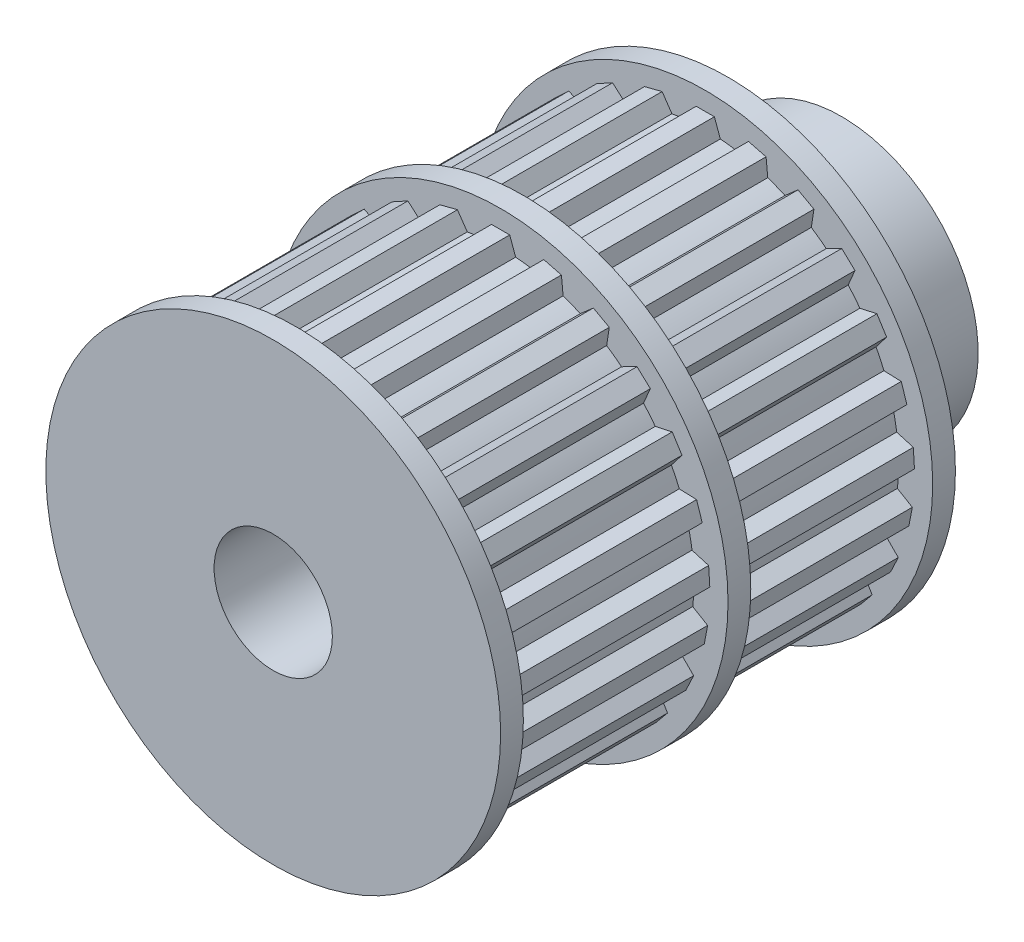
from build123d import *

# Parameters (mm, degrees)
BOSS_EXTRUDE1_DEPTH = 5
SKETCH2_R           = 10
BOSS_EXTRUDE2_DEPTH = 1
MIRROR3_START       = 5
MIRROR3_DEPTH       = 10
SKETCH4_R           = 6
BOSS_EXTRUDE3_DEPTH = 5
CUT_EXTRUDE1_REACH  = 30.723
SKETCH5_R           = 2.6


# Read off the part's stored shape, not the designer's step: Mirror3
with BuildPart() as part:
    # Sketch1 → Boss-Extrude1 (new, symmetric)
    with BuildSketch(Plane.XY):
        with BuildLine():
            Line((-0.4, 9.191300234), (-0.660980834, 8.474261286))
            ThreePointArc((-0.660980834, 8.474261286), (-1.065332485, 8.432974961), (-1.467248177, 8.372406033))
            Line((-1.467248177, 8.372406033), (-1.898350154, 9.002014591))
            Line((-1.898350154, 9.002014591), (-2.673216683, 8.803062681))
            Line((-2.673216683, 8.803062681), (-2.747677989, 8.043647535))
            ThreePointArc((-2.747677989, 8.043647535), (-3.129058698, 7.90310013), (-3.503284589, 7.744481718))
            Line((-3.503284589, 7.744481718), (-4.077419986, 8.247099263))
            Line((-4.077419986, 8.247099263), (-4.77846533, 7.861696324))
            Line((-4.77846533, 7.861696324), (-4.66172843, 7.107621828))
            ThreePointArc((-4.66172843, 7.107621828), (-4.996174644, 6.876644452), (-5.319196746, 6.629943135))
            Line((-5.319196746, 6.629943135), (-6.000290524, 6.973988359))
            Line((-6.000290524, 6.973988359), (-6.583465426, 6.426350674))
            Line((-6.583465426, 6.426350674), (-6.282865329, 5.724998101))
            ThreePointArc((-6.282865329, 5.724998101), (-6.549362564, 5.418103913), (-6.80088421, 5.098820841))
            Line((-6.80088421, 5.098820841), (-7.546140742, 5.262676117))
            Line((-7.546140742, 5.262676117), (-7.974802178, 4.587213776))
            Line((-7.974802178, 4.587213776), (-7.509226693, 3.982651688))
            ThreePointArc((-7.509226693, 3.982651688), (-7.691029946, 3.619123978), (-7.855247106, 3.247320882))
            Line((-7.855247106, 3.247320882), (-8.617839183, 3.220690579))
            Line((-8.617839183, 3.220690579), (-8.865052779, 2.459845366))
            Line((-8.865052779, 2.459845366), (-8.263755727, 1.990060623))
            ThreePointArc((-8.263755727, 1.990060623), (-8.349441631, 1.592741174), (-8.416035937, 1.191779808))
            Line((-8.416035937, 1.191779808), (-9.148047095, 0.976337208))
            Line((-9.148047095, 0.976337208), (-9.198279511, 0.177915826))
            Line((-9.198279511, 0.177915826), (-8.499042597, -0.127573271))
            ThreePointArc((-8.499042597, -0.127573271), (-8.483227192, -0.533719416), (-8.448014278, -0.938645173))
            Line((-8.448014278, -0.938645173), (-9.103449564, -1.32936302))
            Line((-9.103449564, -1.32936302), (-8.953544512, -2.115192821))
            Line((-8.953544512, -2.115192821), (-8.200303363, -2.237191266))
            ThreePointArc((-8.200303363, -2.237191266), (-8.083980389, -2.626644452), (-7.949172812, -3.010091627))
            Line((-7.949172812, -3.010091627), (-8.486848816, -3.551534481))
            Line((-8.486848816, -3.551534481), (-8.146225383, -4.275396123))
            Line((-8.146225383, -4.275396123), (-7.38630891, -4.206238307))
            ThreePointArc((-7.38630891, -4.206238307), (-7.176787367, -4.554527757), (-6.950855584, -4.892402953))
            Line((-6.950855584, -4.892402953), (-7.336988145, -5.550549969))
            Line((-7.336988145, -5.550549969), (-6.827048953, -6.166960564))
            Line((-6.827048953, -6.166960564), (-6.108205503, -5.910991925))
            ThreePointArc((-6.108205503, -5.910991925), (-5.8186504, -6.196233333), (-5.515790536, -6.467306608))
            Line((-5.515790536, -6.467306608), (-5.726117525, -7.200803989))
            Line((-5.726117525, -7.200803989), (-5.078903929, -7.671032191))
            Line((-5.078903929, -7.671032191), (-4.44630108, -7.244336181))
            ThreePointArc((-4.44630108, -7.244336181), (-4.09490623, -7.44860678), (-3.734148082, -7.635845605))
            Line((-3.734148082, -7.635845605), (-3.755453882, -8.398605012))
            Line((-3.755453882, -8.398605012), (-3.011632693, -8.693104654))
            Line((-3.011632693, -8.693104654), (-2.505019208, -8.122492153))
            ThreePointArc((-2.505019208, -8.122492153), (-2.113864041, -8.23295687), (-1.717875372, -8.324596339))
            Line((-1.717875372, -8.324596339), (-1.54882126, -9.068690793))
            Line((-1.54882126, -9.068690793), (-0.755129499, -9.16895738))
            Line((-0.755129499, -9.16895738), (-0.406337766, -8.49028207))
            ThreePointArc((-0.406337766, -8.49028207), (0, -8.5), (0.406337766, -8.49028207))
            Line((0.406337766, -8.49028207), (0.755129499, -9.16895738))
            Line((0.755129499, -9.16895738), (1.54882126, -9.068690793))
            Line((1.54882126, -9.068690793), (1.717875372, -8.324596339))
            ThreePointArc((1.717875372, -8.324596339), (2.113864041, -8.23295687), (2.505019208, -8.122492153))
            Line((2.505019208, -8.122492153), (3.011632693, -8.693104654))
            Line((3.011632693, -8.693104654), (3.755453882, -8.398605012))
            Line((3.755453882, -8.398605012), (3.734148082, -7.635845605))
            ThreePointArc((3.734148082, -7.635845605), (4.09490623, -7.44860678), (4.44630108, -7.244336181))
            Line((4.44630108, -7.244336181), (5.078903929, -7.671032191))
            Line((5.078903929, -7.671032191), (5.726117525, -7.200803989))
            Line((5.726117525, -7.200803989), (5.515790536, -6.467306608))
            ThreePointArc((5.515790536, -6.467306608), (5.8186504, -6.196233333), (6.108205503, -5.910991925))
            Line((6.108205503, -5.910991925), (6.827048953, -6.166960564))
            Line((6.827048953, -6.166960564), (7.336988145, -5.550549969))
            Line((7.336988145, -5.550549969), (6.950855584, -4.892402953))
            ThreePointArc((6.950855584, -4.892402953), (7.176787367, -4.554527757), (7.38630891, -4.206238307))
            Line((7.38630891, -4.206238307), (8.146225383, -4.275396123))
            Line((8.146225383, -4.275396123), (8.486848816, -3.551534481))
            Line((8.486848816, -3.551534481), (7.949172812, -3.010091627))
            ThreePointArc((7.949172812, -3.010091627), (8.083980389, -2.626644452), (8.200303363, -2.237191266))
            Line((8.200303363, -2.237191266), (8.953544512, -2.115192821))
            Line((8.953544512, -2.115192821), (9.103449564, -1.32936302))
            Line((9.103449564, -1.32936302), (8.448014278, -0.938645173))
            ThreePointArc((8.448014278, -0.938645173), (8.483227192, -0.533719416), (8.499042597, -0.127573271))
            Line((8.499042597, -0.127573271), (9.198279511, 0.177915826))
            Line((9.198279511, 0.177915826), (9.148047095, 0.976337208))
            Line((9.148047095, 0.976337208), (8.416035937, 1.191779808))
            ThreePointArc((8.416035937, 1.191779808), (8.349441631, 1.592741174), (8.263755727, 1.990060623))
            Line((8.263755727, 1.990060623), (8.865052779, 2.459845366))
            Line((8.865052779, 2.459845366), (8.617839183, 3.220690579))
            Line((8.617839183, 3.220690579), (7.855247106, 3.247320882))
            ThreePointArc((7.855247106, 3.247320882), (7.691029946, 3.619123978), (7.509226693, 3.982651688))
            Line((7.509226693, 3.982651688), (7.974802178, 4.587213776))
            Line((7.974802178, 4.587213776), (7.546140742, 5.262676117))
            Line((7.546140742, 5.262676117), (6.80088421, 5.098820841))
            ThreePointArc((6.80088421, 5.098820841), (6.549362564, 5.418103913), (6.282865329, 5.724998101))
            Line((6.282865329, 5.724998101), (6.583465426, 6.426350674))
            Line((6.583465426, 6.426350674), (6.000290524, 6.973988359))
            Line((6.000290524, 6.973988359), (5.319196746, 6.629943135))
            ThreePointArc((5.319196746, 6.629943135), (4.996174644, 6.876644452), (4.66172843, 7.107621828))
            Line((4.66172843, 7.107621828), (4.77846533, 7.861696324))
            Line((4.77846533, 7.861696324), (4.077419986, 8.247099263))
            Line((4.077419986, 8.247099263), (3.503284589, 7.744481718))
            ThreePointArc((3.503284589, 7.744481718), (3.129058698, 7.90310013), (2.747677989, 8.043647535))
            Line((2.747677989, 8.043647535), (2.673216683, 8.803062681))
            Line((2.673216683, 8.803062681), (1.898350154, 9.002014591))
            Line((1.898350154, 9.002014591), (1.467248177, 8.372406033))
            ThreePointArc((1.467248177, 8.372406033), (1.065332485, 8.432974961), (0.660980834, 8.474261286))
            Line((0.660980834, 8.474261286), (0.4, 9.191300234))
            Line((0.4, 9.191300234), (-0.4, 9.191300234))
        make_face()
    extrude(amount=BOSS_EXTRUDE1_DEPTH, both=True)

    # Sketch2 → Boss-Extrude2 (add)
    with BuildSketch(Plane.XY.offset(5)):
        Circle(SKETCH2_R)
    boss_extrude2 = extrude(amount=-BOSS_EXTRUDE2_DEPTH)

    # Mirror3 outline → Mirror3 (add)
    with BuildSketch(Plane.XY.offset(MIRROR3_START)):
        with BuildLine():
            Line((0.660980834, 8.474261286), (0.4, 9.191300234))
            Line((0.4, 9.191300234), (-0.4, 9.191300234))
            Line((-0.4, 9.191300234), (-0.660980834, 8.474261286))
            ThreePointArc((-0.660980834, 8.474261286), (-1.065332485, 8.432974961), (-1.467248177, 8.372406033))
            Line((-1.467248177, 8.372406033), (-1.898350154, 9.002014591))
            Line((-1.898350154, 9.002014591), (-2.673216683, 8.803062681))
            Line((-2.673216683, 8.803062681), (-2.747677989, 8.043647535))
            ThreePointArc((-2.747677989, 8.043647535), (-3.129058698, 7.90310013), (-3.503284589, 7.744481718))
            Line((-3.503284589, 7.744481718), (-4.077419986, 8.247099263))
            Line((-4.077419986, 8.247099263), (-4.77846533, 7.861696324))
            Line((-4.77846533, 7.861696324), (-4.66172843, 7.107621828))
            ThreePointArc((-4.66172843, 7.107621828), (-4.996174644, 6.876644452), (-5.319196746, 6.629943135))
            Line((-5.319196746, 6.629943135), (-6.000290524, 6.973988359))
            Line((-6.000290524, 6.973988359), (-6.583465426, 6.426350674))
            Line((-6.583465426, 6.426350674), (-6.282865329, 5.724998101))
            ThreePointArc((-6.282865329, 5.724998101), (-6.549362564, 5.418103913), (-6.80088421, 5.098820841))
            Line((-6.80088421, 5.098820841), (-7.546140742, 5.262676117))
            Line((-7.546140742, 5.262676117), (-7.974802178, 4.587213776))
            Line((-7.974802178, 4.587213776), (-7.509226693, 3.982651688))
            ThreePointArc((-7.509226693, 3.982651688), (-7.691029946, 3.619123979), (-7.855247106, 3.247320882))
            Line((-7.855247106, 3.247320882), (-8.617839183, 3.220690579))
            Line((-8.617839183, 3.220690579), (-8.865052779, 2.459845366))
            Line((-8.865052779, 2.459845366), (-8.263755727, 1.990060623))
            ThreePointArc((-8.263755727, 1.990060623), (-8.349441631, 1.592741174), (-8.416035937, 1.191779808))
            Line((-8.416035937, 1.191779808), (-9.148047095, 0.976337208))
            Line((-9.148047095, 0.976337208), (-9.198279511, 0.177915826))
            Line((-9.198279511, 0.177915826), (-8.499042597, -0.127573271))
            ThreePointArc((-8.499042597, -0.127573271), (-8.483227192, -0.533719416), (-8.448014278, -0.938645173))
            Line((-8.448014278, -0.938645173), (-9.103449564, -1.32936302))
            Line((-9.103449564, -1.32936302), (-8.953544512, -2.115192821))
            Line((-8.953544512, -2.115192821), (-8.200303363, -2.237191266))
            ThreePointArc((-8.200303363, -2.237191266), (-8.083980389, -2.626644452), (-7.949172812, -3.010091627))
            Line((-7.949172812, -3.010091627), (-8.486848816, -3.551534481))
            Line((-8.486848816, -3.551534481), (-8.146225383, -4.275396123))
            Line((-8.146225383, -4.275396123), (-7.38630891, -4.206238307))
            ThreePointArc((-7.38630891, -4.206238307), (-7.176787367, -4.554527757), (-6.950855584, -4.892402953))
            Line((-6.950855584, -4.892402953), (-7.336988145, -5.550549969))
            Line((-7.336988145, -5.550549969), (-6.827048953, -6.166960564))
            Line((-6.827048953, -6.166960564), (-6.108205503, -5.910991925))
            ThreePointArc((-6.108205503, -5.910991925), (-5.8186504, -6.196233333), (-5.515790536, -6.467306608))
            Line((-5.515790536, -6.467306608), (-5.726117525, -7.200803989))
            Line((-5.726117525, -7.200803989), (-5.078903929, -7.671032191))
            Line((-5.078903929, -7.671032191), (-4.44630108, -7.244336181))
            ThreePointArc((-4.44630108, -7.244336181), (-4.09490623, -7.44860678), (-3.734148082, -7.635845605))
            Line((-3.734148082, -7.635845605), (-3.755453882, -8.398605012))
            Line((-3.755453882, -8.398605012), (-3.011632693, -8.693104654))
            Line((-3.011632693, -8.693104654), (-2.505019208, -8.122492153))
            ThreePointArc((-2.505019208, -8.122492153), (-2.113864041, -8.23295687), (-1.717875372, -8.324596339))
            Line((-1.717875372, -8.324596339), (-1.54882126, -9.068690793))
            Line((-1.54882126, -9.068690793), (-0.755129499, -9.16895738))
            Line((-0.755129499, -9.16895738), (-0.406337766, -8.49028207))
            ThreePointArc((-0.406337766, -8.49028207), (0, -8.5), (0.406337766, -8.49028207))
            Line((0.406337766, -8.49028207), (0.755129499, -9.16895738))
            Line((0.755129499, -9.16895738), (1.54882126, -9.068690793))
            Line((1.54882126, -9.068690793), (1.717875372, -8.324596339))
            ThreePointArc((1.717875372, -8.324596339), (2.113864041, -8.23295687), (2.505019208, -8.122492153))
            Line((2.505019208, -8.122492153), (3.011632693, -8.693104654))
            Line((3.011632693, -8.693104654), (3.755453882, -8.398605012))
            Line((3.755453882, -8.398605012), (3.734148082, -7.635845605))
            ThreePointArc((3.734148082, -7.635845605), (4.09490623, -7.44860678), (4.44630108, -7.244336181))
            Line((4.44630108, -7.244336181), (5.078903929, -7.671032191))
            Line((5.078903929, -7.671032191), (5.726117525, -7.200803989))
            Line((5.726117525, -7.200803989), (5.515790536, -6.467306608))
            ThreePointArc((5.515790536, -6.467306608), (5.8186504, -6.196233333), (6.108205503, -5.910991925))
            Line((6.108205503, -5.910991925), (6.827048953, -6.166960564))
            Line((6.827048953, -6.166960564), (7.336988145, -5.550549969))
            Line((7.336988145, -5.550549969), (6.950855584, -4.892402953))
            ThreePointArc((6.950855584, -4.892402953), (7.176787367, -4.554527757), (7.38630891, -4.206238307))
            Line((7.38630891, -4.206238307), (8.146225383, -4.275396123))
            Line((8.146225383, -4.275396123), (8.486848816, -3.551534481))
            Line((8.486848816, -3.551534481), (7.949172812, -3.010091627))
            ThreePointArc((7.949172812, -3.010091627), (8.083980389, -2.626644452), (8.200303363, -2.237191266))
            Line((8.200303363, -2.237191266), (8.953544512, -2.115192821))
            Line((8.953544512, -2.115192821), (9.103449564, -1.32936302))
            Line((9.103449564, -1.32936302), (8.448014278, -0.938645173))
            ThreePointArc((8.448014278, -0.938645173), (8.483227192, -0.533719416), (8.499042597, -0.127573271))
            Line((8.499042597, -0.127573271), (9.198279511, 0.177915826))
            Line((9.198279511, 0.177915826), (9.148047095, 0.976337208))
            Line((9.148047095, 0.976337208), (8.416035937, 1.191779808))
            ThreePointArc((8.416035937, 1.191779808), (8.349441631, 1.592741174), (8.263755727, 1.990060623))
            Line((8.263755727, 1.990060623), (8.865052779, 2.459845366))
            Line((8.865052779, 2.459845366), (8.617839183, 3.220690579))
            Line((8.617839183, 3.220690579), (7.855247106, 3.247320882))
            ThreePointArc((7.855247106, 3.247320882), (7.691029946, 3.619123979), (7.509226693, 3.982651688))
            Line((7.509226693, 3.982651688), (7.974802178, 4.587213776))
            Line((7.974802178, 4.587213776), (7.546140742, 5.262676117))
            Line((7.546140742, 5.262676117), (6.80088421, 5.098820841))
            ThreePointArc((6.80088421, 5.098820841), (6.549362564, 5.418103913), (6.282865329, 5.724998101))
            Line((6.282865329, 5.724998101), (6.583465426, 6.426350674))
            Line((6.583465426, 6.426350674), (6.000290524, 6.973988359))
            Line((6.000290524, 6.973988359), (5.319196746, 6.629943135))
            ThreePointArc((5.319196746, 6.629943135), (4.996174644, 6.876644452), (4.66172843, 7.107621828))
            Line((4.66172843, 7.107621828), (4.77846533, 7.861696324))
            Line((4.77846533, 7.861696324), (4.077419986, 8.247099263))
            Line((4.077419986, 8.247099263), (3.503284589, 7.744481718))
            ThreePointArc((3.503284589, 7.744481718), (3.129058698, 7.90310013), (2.747677989, 8.043647535))
            Line((2.747677989, 8.043647535), (2.673216683, 8.803062681))
            Line((2.673216683, 8.803062681), (1.898350154, 9.002014591))
            Line((1.898350154, 9.002014591), (1.467248177, 8.372406033))
            ThreePointArc((1.467248177, 8.372406033), (1.065332485, 8.432974961), (0.660980834, 8.474261286))
        make_face()
    extrude(amount=MIRROR3_DEPTH)

    # Mirror1: Boss-Extrude2 across plane
    add(boss_extrude2.mirror(Plane.XY))

    # Mirror5: Boss-Extrude2 across plane
    add(boss_extrude2.mirror(Plane.XY.offset(9.5)))

    # Sketch4 → Boss-Extrude3 (add)
    with BuildSketch(Plane(origin=(0, 0, -5), x_dir=(-1, 0, 0), z_dir=(0, 0, -1))):
        Circle(SKETCH4_R)
    extrude(amount=BOSS_EXTRUDE3_DEPTH)

    # Sketch5 → Cut-Extrude1 (cut, up to next)
    with BuildSketch(Plane.XY.offset(15), mode=Mode.PRIVATE) as cut_extrude1_sk1:
        Circle(SKETCH5_R)
    cut_extrude1_tool1 = extrude(cut_extrude1_sk1.sketch, amount=-CUT_EXTRUDE1_REACH, mode=Mode.PRIVATE) & part.part
    add(cut_extrude1_tool1.solids().sort_by_distance((0, 0, 15))[0], mode=Mode.SUBTRACT)


solid = part.part
